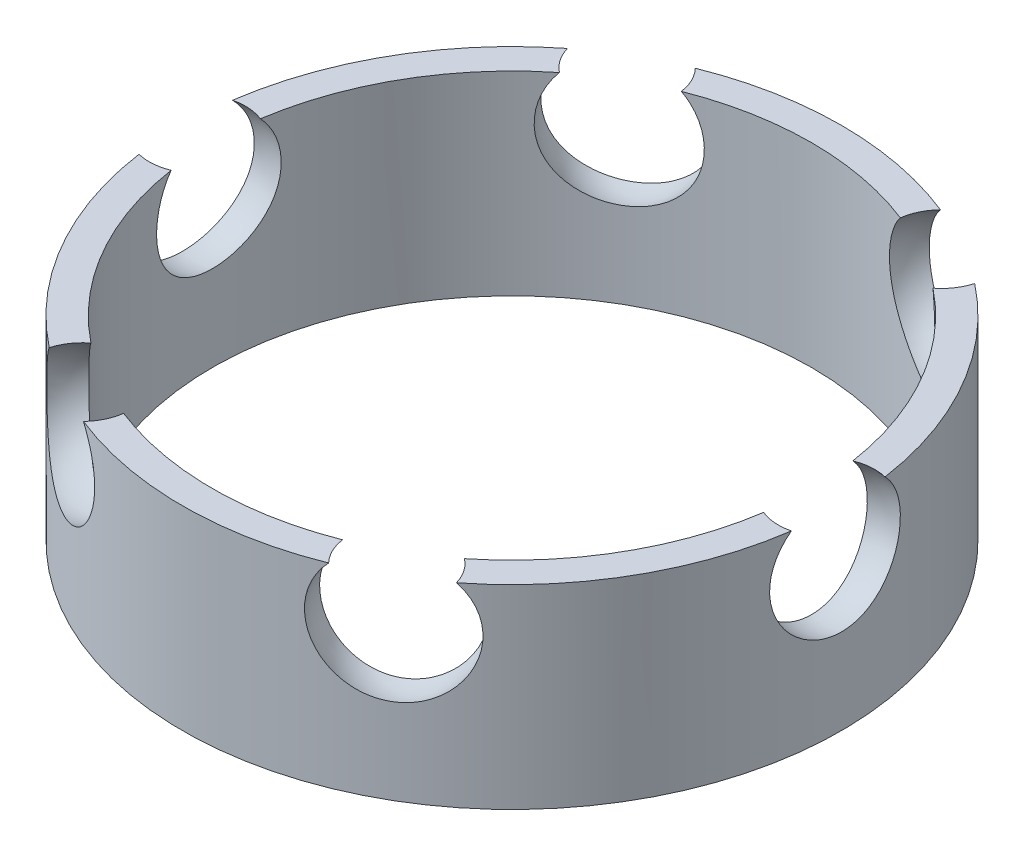
from build123d import *

# Parameters (mm, degrees)
SKETCH3_W          = 1
SKETCH3_H          = 10
CIRPATTERN1_COUNT  = 6
SKETCH5_R          = 11
SKETCH5_R_2        = 10
CUT_EXTRUDE1_DEPTH = 3.5


with BuildPart() as part:
    # Sketch3 → Revolve3 (revolve)
    with BuildSketch(Plane.XY):
        with Locations((10.5, 0)):
            Rectangle(SKETCH3_W, SKETCH3_H)
    revolve(axis=Axis((0, 0, 0), (0, 1, 0)))

    # Sketch4 → Cut-Revolve1 (revolve, cut)
    with BuildSketch(Plane.XY):
        with BuildLine():
            Line((10.5, 2.2), (10.5, -2.2))
            ThreePointArc((10.5, -2.2), (12.055634919, -1.555634919), (12.7, 0))
            ThreePointArc((12.7, 0), (12.055634919, 1.555634919), (10.5, 2.2))
        make_face()
    cut_revolve1 = revolve(axis=Axis((10.5, -2.2, 0), (0, 1, 0)), mode=Mode.SUBTRACT)

    # CirPattern1: Cut-Revolve1 ×6 about axis
    cirpattern1_axis = Axis((0, 5, 0), (0, -1, 0))
    for i in range(1, CIRPATTERN1_COUNT):
        add(cut_revolve1.rotate(cirpattern1_axis, i * 360 / CIRPATTERN1_COUNT), mode=Mode.SUBTRACT)

    # Sketch5 → Cut-Extrude1 (cut)
    with BuildSketch(Plane(origin=(0, 5, 0), x_dir=(1, 0, 0), z_dir=(0, 1, 0))):
        Circle(SKETCH5_R)
        Circle(SKETCH5_R_2, mode=Mode.SUBTRACT)
    extrude(amount=-CUT_EXTRUDE1_DEPTH, mode=Mode.SUBTRACT)


solid = part.part
